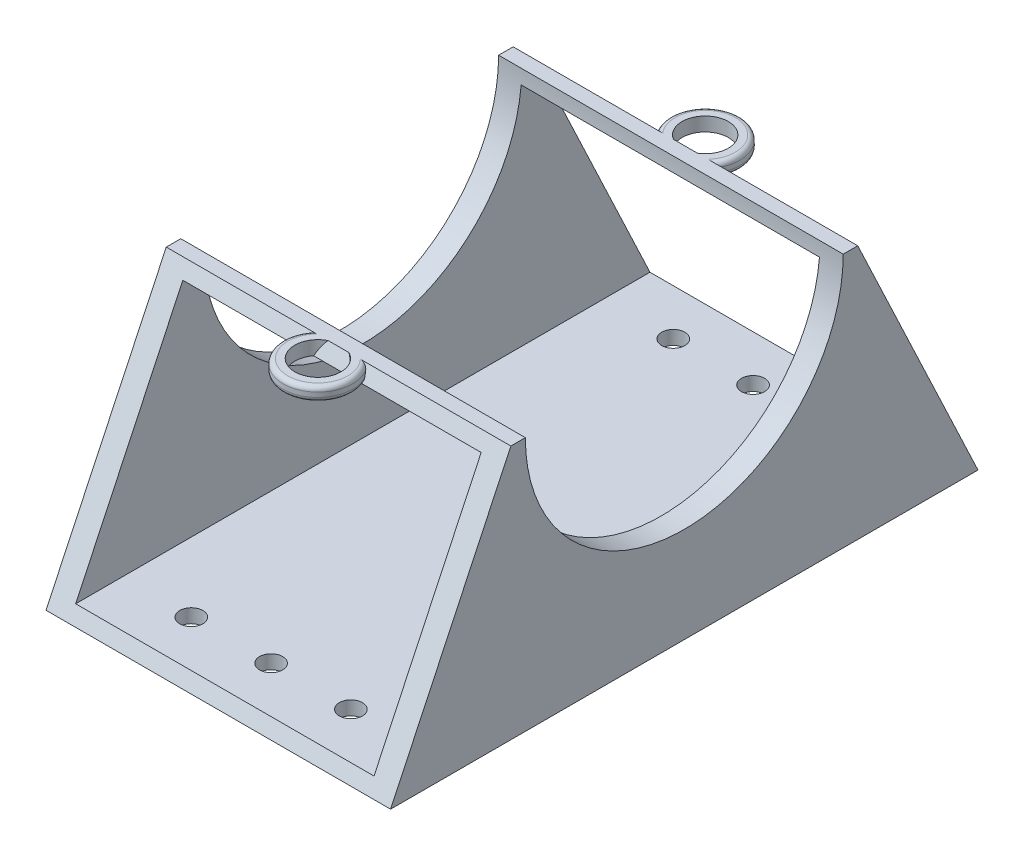
from build123d import *

# Parameters (mm, degrees)
SKETCH1_W               = 74.5
SKETCH1_H               = 75
BOSS_EXTRUDE1_DEPTH     = 55
SKETCH5_R               = 34.3615522135402
CUT_EXTRUDE2_DEPTH      = 100.90745717913153
BOSS_EXTRUDE3_DEPTH     = 74.5
BOSS_EXTRUDE4_DEPTH     = 74.5
CUT_EXTRUDE3_DEPTH      = 121.88656873284145
CUT_EXTRUDE3_DEPTH_BACK = 121.88656873284145
SKETCH9_W               = 64.5
SKETCH9_H               = 49.00000000000001
BOSS_EXTRUDE5_DEPTH     = 3
BOSS_EXTRUDE6_DEPTH     = 3
FILLET1_R               = 1
SKETCH12_R              = 2.499999999999999
SKETCH12_R_2            = 2.5000000000000027
SKETCH12_R_3            = 2.5000000000000018
CUT_EXTRUDE4_DEPTH      = 91.13219475054404
LPATTERN1_COUNT         = 2
LPATTERN1_PITCH         = 104.2


with BuildPart() as part:
    # Sketch1 → Boss-Extrude1 (new body)
    with BuildSketch(Plane(origin=(0, 0, 0), x_dir=(1, 0, 0), z_dir=(0, 1, 0))):
        Rectangle(SKETCH1_W, SKETCH1_H)
    extrude(amount=BOSS_EXTRUDE1_DEPTH)

    # Sketch5 → Cut-Extrude2 (cut, through all)
    with BuildSketch(Plane(origin=(37.25, 0, 0), x_dir=(0, 0, -1), z_dir=(1, 0, 0))):
        with Locations((6.94e-15, 55)):
            Circle(SKETCH5_R)
    extrude(amount=-CUT_EXTRUDE2_DEPTH, mode=Mode.SUBTRACT)

    # Sketch7 → Boss-Extrude3 (add)
    with BuildSketch(Plane(origin=(37.25, 0, 0), x_dir=(0, 0, -1), z_dir=(1, 0, 0))):
        Polygon((-37.49999999999999, 55), (-63.5, 0), (-37.49999999999999, 0), align=None)
    extrude(amount=-BOSS_EXTRUDE3_DEPTH)

    # Sketch8 → Boss-Extrude4 (add)
    with BuildSketch(Plane(origin=(37.25, 0, 0), x_dir=(0, 0, -1), z_dir=(1, 0, 0))):
        Polygon((37.50000000000001, 55), (63.5, -2.4e-16), (37.50000000000001, 0), align=None)
    extrude(amount=-BOSS_EXTRUDE4_DEPTH)

    # Sketch9 → Cut-Extrude3 (cut, two sides: drawn at the far end of the back side and taken through both)
    with BuildSketch(Plane.XY.offset(37.49999999999999).offset(-CUT_EXTRUDE3_DEPTH_BACK)):
        with Locations((0, 27.500000000000004)):
            Rectangle(SKETCH9_W, SKETCH9_H)
    extrude(amount=CUT_EXTRUDE3_DEPTH + CUT_EXTRUDE3_DEPTH_BACK, mode=Mode.SUBTRACT)

    # Sketch10 → Boss-Extrude5 (add)
    with BuildSketch(Plane(origin=(0, 55, 0), x_dir=(1, 0, 0), z_dir=(0, 1, 0))):
        with BuildLine():
            ThreePointArc((6.164042343036378, 37.499999999999844), (7.158223158465123, 39.534270662732936), (7.5, 41.77253812074898))
            ThreePointArc((7.5, 41.77253812074898), (-2.2382674580157964, 48.93076127921418), (-6.164042343036669, 37.50000000000026))
            Line((-6.164042343036755, 37.50000000000001), (-2.5971942566442934, 37.50000000000001))
            ThreePointArc((-2.5971942566443156, 37.499999999999936), (-2.4509211244732474, 46.1306323879271), (4.999999999999999, 41.77253812074898))
            ThreePointArc((4.999999999999999, 41.77253812074898), (4.358094267178168, 39.32161699627582), (2.5971942566444843, 37.50000000000004))
            Line((2.5971942566444923, 37.50000000000001), (6.164042343036321, 37.50000000000001))
        make_face()
    extrude(amount=-BOSS_EXTRUDE5_DEPTH)

    # Sketch11 → Boss-Extrude6 (add)
    with BuildSketch(Plane(origin=(0, 55, 0), x_dir=(1, 0, 0), z_dir=(0, 1, 0))):
        with BuildLine():
            ThreePointArc((-6.023640204727232, -37.49999999999989), (-2.3529448000904902, -49.08965777094965), (7.5, -41.96830601951038))
            ThreePointArc((7.5, -41.96830601951038), (7.121351751439286, -39.615361219419945), (6.023640204727302, -37.499999999999986))
            Line((6.0236402047273, -37.49999999999999), (2.2437115046296583, -37.49999999999999))
            ThreePointArc((2.243711504629653, -37.500000000000014), (4.255499825117389, -39.34328768844565), (4.999999999999999, -41.96830601951038))
            ThreePointArc((4.999999999999999, -41.96830601951038), (-2.6250183310647546, -46.223805844627755), (-2.2437115046296032, -37.49999999999999))
            Line((-2.2437115046296014, -37.49999999999999), (-6.023640204727201, -37.49999999999999))
        make_face()
        with BuildLine():
            Line((2.2437115046296583, -37.49999999999999), (6.0236402047273, -37.49999999999999))
            ThreePointArc((6.023640204727302, -37.499999999999986), (5.875e-14, -34.46830601951038), (-6.023640204727232, -37.49999999999989))
            Line((-6.023640204727201, -37.49999999999999), (-2.2437115046296014, -37.49999999999999))
            ThreePointArc((-2.2437115046296032, -37.49999999999999), (2.806e-14, -36.96830601951038), (2.243711504629653, -37.500000000000014))
        make_face()
    extrude(amount=-BOSS_EXTRUDE6_DEPTH)

    # Fillet1
    # the kernel refuses this fillet: 1 mm, written as the material it takes off along each edge
    with BuildSketch(Plane(origin=(-3.55e-15, 55, 41.96830601951038), x_dir=(1, 0, 0), z_dir=(0, 0, -1))) as fillet1_piece_1_section:
        with BuildLine():
            CenterArc((7.5 - FILLET1_R, FILLET1_R), FILLET1_R, 270, 90)
            Line((7.5, FILLET1_R), (7.5, 0))
            Line((7.5, 0), (7.5 - FILLET1_R, 0))
        make_face()
    fillet1_piece_1 = revolve(axis=Axis((-3.55e-15, 55, 41.96830601951038), (0, -1, 0)), revolution_arc=235.71091499042655, mode=Mode.PRIVATE)
    fillet1_piece_1 = split(fillet1_piece_1, bisect_by=Plane(origin=(-2.6713999236626833, 50.45322927533666, 39.6493825243863), z_dir=(0, 0.42737961689341636, 0.9040722665053036)), keep=Keep.TOP, mode=Mode.PRIVATE)
    add(fillet1_piece_1, mode=Mode.SUBTRACT)
    with BuildSketch(Plane(origin=(1.78e-15, 52, 41.96830601951038), x_dir=(-0.7297482724094352, 0, -0.6837159197469698), z_dir=(0.6837159197469698, 0, -0.7297482724094352))) as fillet1_piece_2_section:
        with BuildLine():
            CenterArc((7.500000000000202 - FILLET1_R, FILLET1_R), FILLET1_R, 270, 90)
            Line((7.500000000000198, FILLET1_R), (7.500000000000202, 0))
            Line((7.500000000000202, 0), (7.500000000000202 - FILLET1_R, 0))
        make_face()
    fillet1_piece_2 = revolve(axis=Axis((1.78e-15, 52, 41.96830601951038), (0, 1, 0)), revolution_arc=223.13470500677207, mode=Mode.PRIVATE)
    fillet1_piece_2 = split(fillet1_piece_2, bisect_by=Plane(origin=(-1.7477354157855842, 48.3431338081412, 40.64688219978779), z_dir=(0, 0.42737961689341636, 0.9040722665053036)), keep=Keep.TOP, mode=Mode.PRIVATE)
    add(fillet1_piece_2, mode=Mode.SUBTRACT)
    with BuildSketch(Plane(origin=(1.33e-15, 55, -41.772538120748976), x_dir=(-0.5894081060524027, 0, 0.8078354315822744), z_dir=(0.8078354315822744, 0, 0.5894081060524027))) as fillet1_piece_3_section:
        with BuildLine():
            CenterArc((7.500000000001482 - FILLET1_R, FILLET1_R), FILLET1_R, 270, 90)
            Line((7.500000000001481, FILLET1_R), (7.500000000001482, 0))
            Line((7.500000000001482, 0), (7.500000000001482 - FILLET1_R, 0))
        make_face()
    fillet1_piece_3 = revolve(axis=Axis((1.33e-15, 55, -41.772538120748976), (0, -1, 0)), revolution_arc=287.7699662913145, mode=Mode.PRIVATE)
    fillet1_piece_3 = split(fillet1_piece_3, bisect_by=Plane(origin=(0, 50.33119352274253, -39.70707215288535), z_dir=(0, 0.42737961689341614, -0.9040722665053037)), keep=Keep.TOP, mode=Mode.PRIVATE)
    add(fillet1_piece_3, mode=Mode.SUBTRACT)
    with BuildSketch(Plane(origin=(5.33e-15, 52, -41.77253812074899), x_dir=(0.7487686990913793, 0, 0.662831377697981), z_dir=(-0.662831377697981, 0, 0.7487686990913793))) as fillet1_piece_4_section:
        with BuildLine():
            CenterArc((7.499999999999997 - FILLET1_R, FILLET1_R), FILLET1_R, 269.9999999999997, 90.00000000000028)
            Line((7.499999999999997 - FILLET1_R, 0), (7.499999999999997, 0))
            Line((7.499999999999997, 0), (7.499999999999996, FILLET1_R))
        make_face()
    fillet1_piece_4 = revolve(axis=Axis((5.33e-15, 52, -41.77253812074899), (0, 1, 0)), revolution_arc=263.03233782444397, mode=Mode.PRIVATE)
    fillet1_piece_4 = split(fillet1_piece_4, bisect_by=Plane(origin=(7.11e-15, 48.33525291032238, -40.65060771512034), z_dir=(0, 0.42737961689341614, -0.9040722665053037)), keep=Keep.TOP, mode=Mode.PRIVATE)
    add(fillet1_piece_4, mode=Mode.SUBTRACT)
    with BuildSketch(Plane(origin=(1.78e-15, 52, 41.96830601951038), x_dir=(1, 0, 0), z_dir=(0, 0, 1))) as fillet1_piece_5_section:
        with BuildLine():
            CenterArc((7.499999999999997 - FILLET1_R, FILLET1_R), FILLET1_R, 270, 90)
            Line((7.499999999999998, FILLET1_R), (7.499999999999997, 0))
            Line((7.499999999999997, 0), (7.499999999999997 - FILLET1_R, 0))
        make_face()
    fillet1_piece_5 = revolve(axis=Axis((1.78e-15, 52, 41.96830601951038), (0, 1, 0)), revolution_arc=43.0957883273494, mode=Mode.PRIVATE)
    fillet1_piece_5 = split(fillet1_piece_5, bisect_by=Plane(origin=(7.034955474041542, 51.63351194574045, 39.09143071655905), z_dir=(0, 0.42737961689341636, 0.9040722665053036)), keep=Keep.TOP, mode=Mode.PRIVATE)
    add(fillet1_piece_5, mode=Mode.SUBTRACT)
    with BuildSketch(Plane(origin=(-3.55e-15, 55, 41.96830601951038), x_dir=(0.563991699397745, 0, -0.825780456907551), z_dir=(-0.825780456907551, 0, -0.563991699397745))) as fillet1_piece_6_section:
        with BuildLine():
            CenterArc((7.499999999999998 - FILLET1_R, FILLET1_R), FILLET1_R, 270, 90)
            Line((7.499999999999998, FILLET1_R), (7.499999999999998, 0))
            Line((7.499999999999998, 0), (7.499999999999998 - FILLET1_R, 0))
        make_face()
    fillet1_piece_6 = revolve(axis=Axis((-3.55e-15, 55, 41.96830601951038), (0, -1, 0)), revolution_arc=55.66769762264099, mode=Mode.PRIVATE)
    fillet1_piece_6 = split(fillet1_piece_6, bisect_by=Plane(origin=(6.774695529731854, 53.96765158354673, 37.988019251414265), z_dir=(0, 0.42737961689341636, 0.9040722665053036)), keep=Keep.TOP, mode=Mode.PRIVATE)
    add(fillet1_piece_6, mode=Mode.SUBTRACT)

    # Sketch12 → Cut-Extrude4 (cut, through all)
    with BuildSketch(Plane(origin=(0, 3, 0), x_dir=(1, 0, 0), z_dir=(0, 1, 0))):
        with Locations(Location((-17.25, -52.08181818181816, 0), (0, 0, 270))):
            Circle(SKETCH12_R)
        with Locations(Location((17.25, -52.081818181818164, 0), (0, 0, 270))):
            Circle(SKETCH12_R_2)
        with Locations(Location((0, -52.081818181818164, 0), (0, 0, 270))):
            Circle(SKETCH12_R_3)
    cut_extrude4 = extrude(amount=-CUT_EXTRUDE4_DEPTH, mode=Mode.SUBTRACT)

    # LPattern1: Cut-Extrude4 ×2
    with Locations(*[(0, 0, -i * LPATTERN1_PITCH) for i in range(1, LPATTERN1_COUNT)]):
        add(cut_extrude4, mode=Mode.SUBTRACT)


solid = part.part
